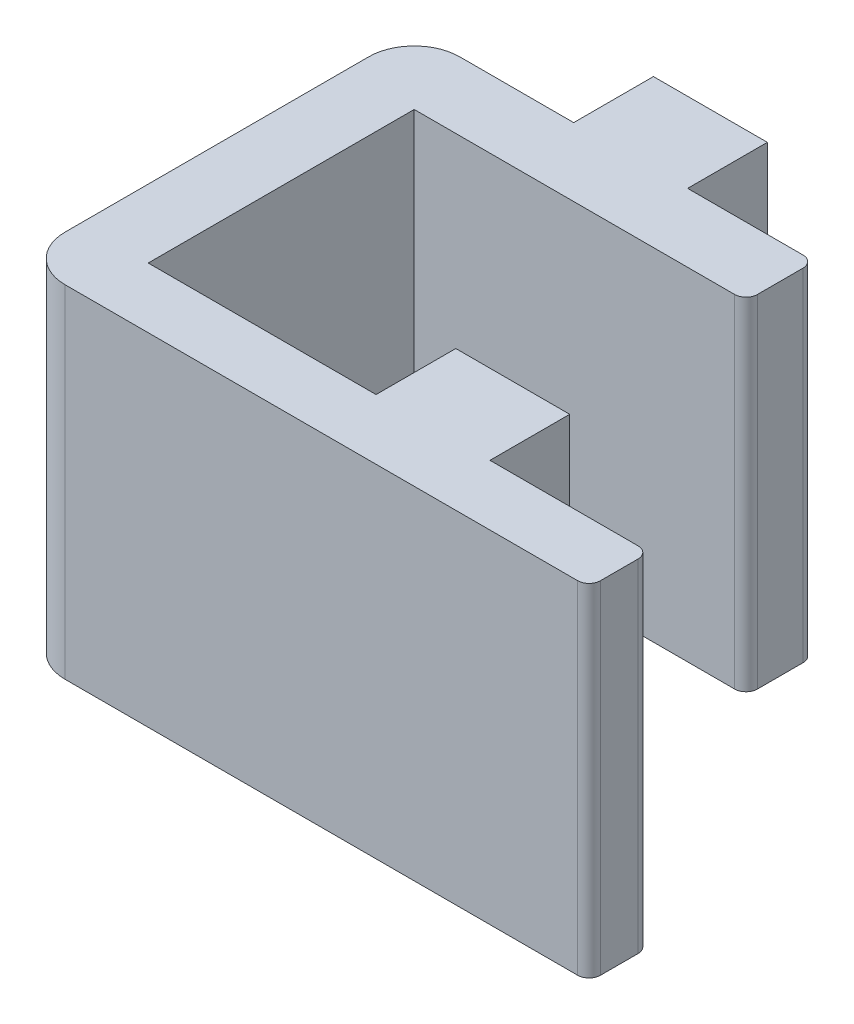
from build123d import *

# Parameters (mm, degrees)
BOSS_EXTRUDE1_DEPTH = 15
SKETCH2_W           = 5
SKETCH2_H           = 15
BOSS_EXTRUDE2_DEPTH = 3.5
SKETCH3_W           = 5
SKETCH3_H           = 15
BOSS_EXTRUDE3_DEPTH = 3.5
FILLET1_R           = 2
FILLET2_R           = 0.5


with BuildPart() as part:
    # Sketch1 → Boss-Extrude1 (new body)
    with BuildSketch(Plane(origin=(0, 0, 0), x_dir=(1, 0, 0), z_dir=(0, 1, 0))):
        Polygon((0, 0), (-25, 0), (-25, 17.325), (-7.435474502, 17.325), (-7.435474502, 14.325), (-22, 14.325), (-22, 2.65), (0, 2.65), align=None)
    extrude(amount=BOSS_EXTRUDE1_DEPTH)

    # Sketch2 → Boss-Extrude2 (add)
    with BuildSketch(Plane(origin=(0, 0, -2.65), x_dir=(-1, 0, 0), z_dir=(0, 0, -1))):
        with Locations((9.5, 7.5)):
            Rectangle(SKETCH2_W, SKETCH2_H)
    extrude(amount=BOSS_EXTRUDE2_DEPTH)

    # Sketch3 → Boss-Extrude3 (add)
    with BuildSketch(Plane(origin=(0, 0, -17.325), x_dir=(-1, 0, 0), z_dir=(0, 0, -1))):
        with Locations((15.5, 7.5)):
            Rectangle(SKETCH3_W, SKETCH3_H)
    extrude(amount=BOSS_EXTRUDE3_DEPTH)

    # Fillet1
    fillet1_edges = [part.edges().sort_by_distance(p)[0] for p in [
        (-25, 7.5, 0),
        (-25, 7.5, -17.325),
    ]]
    fillet(fillet1_edges, radius=FILLET1_R)

    # Fillet2
    fillet2_edges = [part.edges().sort_by_distance(p)[0] for p in [
        (-7.435474502, 7.5, -17.325),
        (-7.435474502, 7.5, -14.325),
        (0, 7.5, 0),
        (0, 7.5, -2.65),
    ]]
    fillet(fillet2_edges, radius=FILLET2_R)


solid = part.part
